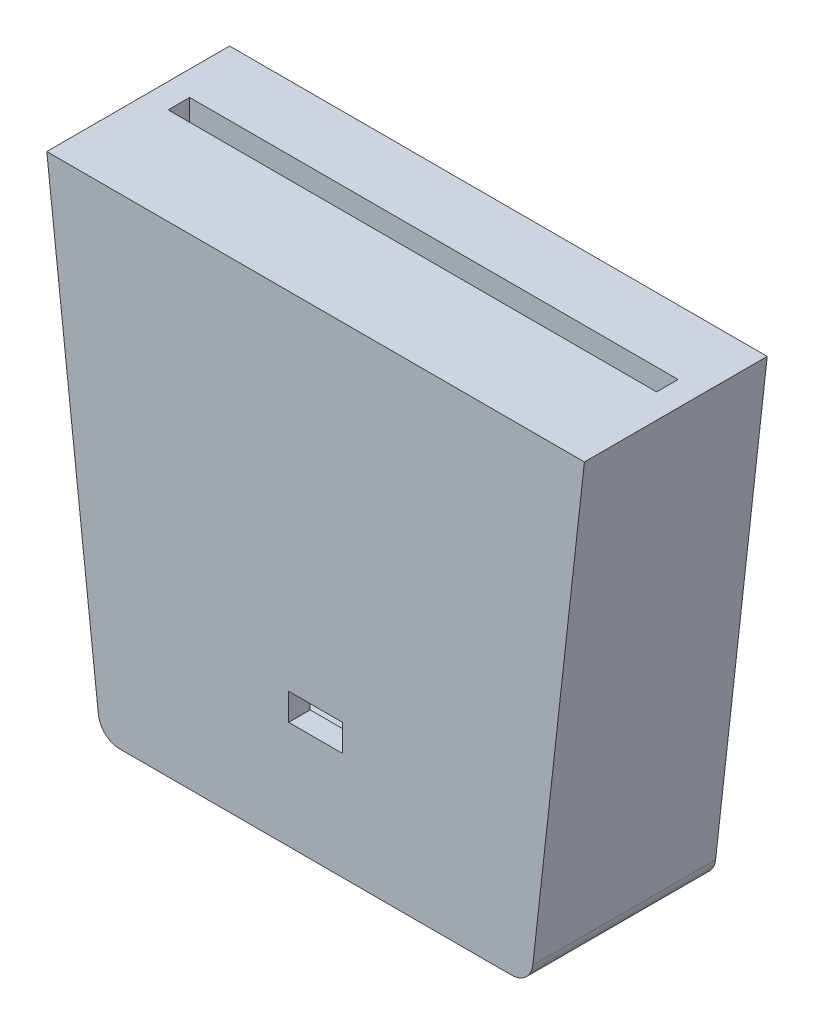
from build123d import *

# Parameters (mm, degrees)
SKETCH1_W           = 12.7
SKETCH1_H           = 6.35
BOSS_EXTRUDE1_DEPTH = 5.08
BOSS_EXTRUDE2_DEPTH = 38.1
SKETCH4_W           = 115.38555028
SKETCH4_H           = 5.08
CUT_EXTRUDE1_DEPTH  = 5.08
BOSS_EXTRUDE3_DEPTH = 2.54
SKETCH7_R           = 1.905
CUT_EXTRUDE2_DEPTH  = 2.54
SKETCH8_W           = 50.17008
SKETCH8_H           = 62.5348
BOSS_EXTRUDE4_DEPTH = 9.017
SKETCH9_W           = 45.09008
SKETCH9_H           = 6.477
CUT_EXTRUDE3_DEPTH  = 61.3918


with BuildPart() as part:
    # Sketch1 → Boss-Extrude1 (new body)
    with BuildSketch(Plane.XY):
        with BuildLine():
            Line((63.5, 56.7961272), (-63.5, 56.7961272))
            Line((-63.5, 56.7961272), (-51.304854459, -52.280570501))
            ThreePointArc((-51.304854459, -52.280570501), (-49.642976536, -55.502534499), (-46.25630987, -56.796126057))
            Line((-46.25630987, -56.796126057), (46.25630987, -56.796126057))
            ThreePointArc((46.25630987, -56.796126057), (49.642976536, -55.502534499), (51.304854459, -52.280570501))
            Line((51.304854459, -52.280570501), (63.5, 56.7961272))
        make_face()
        with Locations((0, -28.221126057)):
            Rectangle(SKETCH1_W, SKETCH1_H, mode=Mode.SUBTRACT)
    extrude(amount=-BOSS_EXTRUDE1_DEPTH)

    # Sketch2 → Boss-Extrude2 (add)
    with BuildSketch(Plane.XY.offset(-5.08)):
        with BuildLine():
            Line((63.5, 56.7961272), (-63.5, 56.7961272))
            Line((-63.5, 56.7961272), (-51.304854459, -52.280570501))
            ThreePointArc((-51.304854459, -52.280570501), (-49.642976536, -55.502534499), (-46.25630987, -56.796126057))
            Line((-46.25630987, -56.796126057), (46.25630987, -56.796126057))
            ThreePointArc((46.25630987, -56.796126057), (49.642976536, -55.502534499), (51.304854459, -52.280570501))
            Line((51.304854459, -52.280570501), (63.5, 56.7961272))
        make_face()
        with BuildLine():
            Line((41.712619739, -51.716126057), (-41.712619739, -51.716126057))
            ThreePointArc((-41.712619739, -51.716126057), (-45.099286406, -50.422534499), (-46.761164329, -47.200570501))
            Line((-46.761164329, -47.200570501), (-57.820387337, 51.7161272))
            Line((-57.820387337, 51.7161272), (57.820387337, 51.7161272))
            Line((57.820387337, 51.7161272), (46.761164329, -47.200570501))
            ThreePointArc((46.761164329, -47.200570501), (45.099286406, -50.422534499), (41.712619739, -51.716126057))
        make_face(mode=Mode.SUBTRACT)
    extrude(amount=-BOSS_EXTRUDE2_DEPTH)

    # Sketch4 → Cut-Extrude1 (cut)
    with BuildSketch(Plane(origin=(0, 56.7961272, -56.7961272), x_dir=(1, 0, 0), z_dir=(0, -1, 0))):
        with Locations((2.54e-06, 31.3961272)):
            Rectangle(SKETCH4_W, SKETCH4_H)
    extrude(amount=CUT_EXTRUDE1_DEPTH, mode=Mode.SUBTRACT)

    # Sketch6 → Boss-Extrude3 (add)
    with BuildSketch(Plane.XY.offset(-43.18)):
        Polygon((-52.99583525, 8.564021488), (-33.94583525, 8.564021488), (-33.94583525, -4.135978512), (-51.575932084, -4.135978512), align=None)
        Polygon((33.94583525, -4.135978512), (51.575932084, -4.135978512), (52.99583525, 8.564021488), (33.94583525, 8.564021488), align=None)
    extrude(amount=BOSS_EXTRUDE3_DEPTH)

    # Sketch7 → Cut-Extrude2 (cut)
    with BuildSketch(Plane.XY.offset(-43.18)):
        with Locations((-43.115859459, 2.214021488)):
            Circle(SKETCH7_R)
        with Locations((43.115859459, 2.214021488)):
            Circle(SKETCH7_R)
    extrude(amount=CUT_EXTRUDE2_DEPTH, mode=Mode.SUBTRACT)

    # Sketch8 → Boss-Extrude4 (add)
    with BuildSketch(Plane(origin=(0, 0, -5.08), x_dir=(-1, 0, 0), z_dir=(0, 0, -1))):
        with Locations((0, 10.2887272)):
            Rectangle(SKETCH8_W, SKETCH8_H)
    extrude(amount=BOSS_EXTRUDE4_DEPTH)

    # Sketch9 → Cut-Extrude3 (cut)
    with BuildSketch(Plane(origin=(0, 41.5561272, 0), x_dir=(1, 0, 0), z_dir=(0, 1, 0))):
        with Locations((0, 8.3185)):
            Rectangle(SKETCH9_W, SKETCH9_H)
    extrude(amount=-CUT_EXTRUDE3_DEPTH, mode=Mode.SUBTRACT)


solid = part.part
